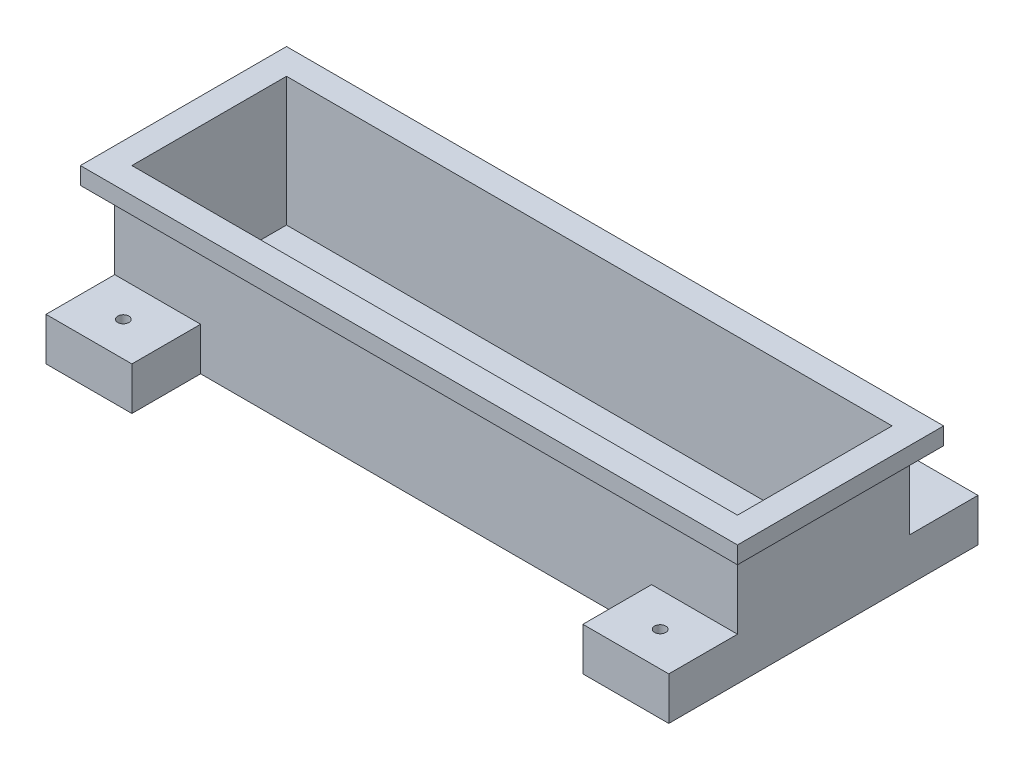
from build123d import *

# Parameters (mm, degrees)
SKETCH1_W           = 145
SKETCH1_H           = 40
SKETCH1_W_2         = 141
SKETCH1_H_2         = 36
BOSS_EXTRUDE1_DEPTH = 30
SKETCH2_W           = 145
SKETCH2_H           = 40
BOSS_EXTRUDE2_DEPTH = 2
SKETCH3_W           = 153
SKETCH3_H           = 48
SKETCH3_W_2         = 145
SKETCH3_H_2         = 40
BOSS_EXTRUDE3_DEPTH = 4
CHAMFER1_SIZE       = 4
SKETCH4_W           = 20
SKETCH4_H           = 16
SKETCH4_R           = 1.3
BOSS_EXTRUDE4_DEPTH = 10


with BuildPart() as part:
    # Sketch1 → Boss-Extrude1 (new body)
    with BuildSketch(Plane(origin=(0, 0, 0), x_dir=(1, 0, 0), z_dir=(0, 1, 0))):
        Rectangle(SKETCH1_W, SKETCH1_H)
        Rectangle(SKETCH1_W_2, SKETCH1_H_2, mode=Mode.SUBTRACT)
    extrude(amount=BOSS_EXTRUDE1_DEPTH)

    # Sketch2 → Boss-Extrude2 (add)
    with BuildSketch(Plane.XZ):
        Rectangle(SKETCH2_W, SKETCH2_H)
    extrude(amount=BOSS_EXTRUDE2_DEPTH)

    # Sketch3 → Boss-Extrude3 (add)
    with BuildSketch(Plane(origin=(0, 30, 0), x_dir=(1, 0, 0), z_dir=(0, 1, 0))):
        Rectangle(SKETCH3_W, SKETCH3_H)
        Rectangle(SKETCH3_W_2, SKETCH3_H_2, mode=Mode.SUBTRACT)
    extrude(amount=-BOSS_EXTRUDE3_DEPTH)

    # Chamfer1
    chamfer1_edges = [part.edges().sort_by_distance(p)[0] for p in [
        (-72.5, 26, 0),
        (0, 26, 20),
        (72.5, 26, 0),
        (0, 26, -20),
    ]]
    chamfer(chamfer1_edges, length=CHAMFER1_SIZE - 0.0001)  # a hair under: the kernel refuses the full size

    # Sketch4 → Boss-Extrude4 (add)
    # profile 1 of 4: a face of its own
    with BuildSketch(Plane.XZ.offset(2)):
        with Locations((62.5, 28)):
            Rectangle(SKETCH4_W, SKETCH4_H)
        with Locations(Location((62.5, 28, 0), (0, 0, 90))):
            Circle(SKETCH4_R, mode=Mode.SUBTRACT)
    # profile 2 of 4: a face of its own
    with BuildSketch(Plane.XZ.offset(2)):
        with Locations((-62.5, 28)):
            Rectangle(SKETCH4_W, SKETCH4_H)
        with Locations(Location((-62.5, 28, 0), (0, 0, 270))):
            Circle(SKETCH4_R, mode=Mode.SUBTRACT)
    # profile 3 of 4: a face of its own
    with BuildSketch(Plane.XZ.offset(2)):
        with Locations((-62.5, -28)):
            Rectangle(SKETCH4_W, SKETCH4_H)
        with Locations(Location((-62.5, -28, 0), (0, 0, 90))):
            Circle(SKETCH4_R, mode=Mode.SUBTRACT)
    # profile 4 of 4: a face of its own
    with BuildSketch(Plane.XZ.offset(2)):
        with Locations((62.5, -28)):
            Rectangle(SKETCH4_W, SKETCH4_H)
        with Locations(Location((62.5, -28, 0), (0, 0, 270))):
            Circle(SKETCH4_R, mode=Mode.SUBTRACT)
    extrude(amount=-BOSS_EXTRUDE4_DEPTH)


solid = part.part
